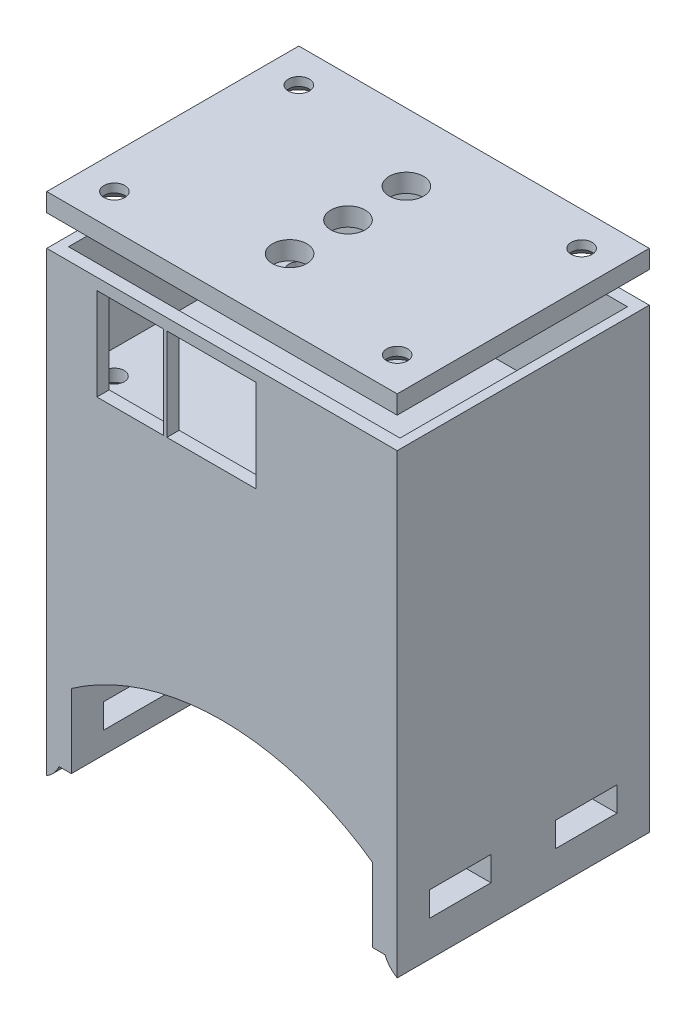
from build123d import *

# Parameters (mm, degrees)
SKETCH_2_W                  = 57
SKETCH_2_H                  = 41
EXTRUDE_1_DEPTH             = 2
SKETCH_1_R                  = 1.6
CUT_EXTRUDE_1_DEPTH         = 2
SKETCH_4_W                  = 57
SKETCH_4_H                  = 41
SKETCH_4_W_2                = 53.914285714
SKETCH_4_H_2                = 37
EXTRUDE_2_DEPTH             = 20
SKETCH_5_W                  = 10.8
SKETCH_5_H                  = 13
SKETCH_5_H_2                = 2
SKETCH_5_W_2                = 14.5
CUT_EXTRUDE_2_DEPTH         = 18.5
EXTRUDE_START               = 25
SKETCH_6_W                  = 57
SKETCH_6_H                  = 41
EXTRUDE_3_DEPTH             = 3
CUT_EXTRUDE_START           = 23
SKETCH_1_2_R                = 1.6
CUT_EXTRUDE_4_DEPTH         = 5
SKETCH_7_R                  = 2.8
CUT_EXTRUDE_5_DEPTH         = 4
SKETCH_8_W                  = 5
SKETCH_8_H                  = 5
CUT_EXTRUDE_6_DEPTH         = 10
SKETCH_9_W                  = 57
SKETCH_9_H                  = 41
EXTRUDE_4_DEPTH             = 40
SKETCH_10_R                 = 1.4
CUT_EXTRUDE_7_DEPTH         = 10
SKETCH_12_W                 = 8
SKETCH_12_H                 = 41
EXTRUDE_5_DEPTH             = 15
SKETCH_13_W                 = 4
SKETCH_13_H                 = 41
CUT_EXTRUDE_8_DEPTH         = 15
SKETCH_14_W                 = 2
SKETCH_14_H                 = 41
CUT_EXTRUDE_9_DEPTH         = 3
SKETCH_15_W                 = 10
SKETCH_15_H                 = 4
CUT_EXTRUDE_10_DEPTH        = 82.818396464
CUT_EXTRUDE_12_DEPTH        = 75.284924446
HOLE_WIZARD_M3_1_AT_2_COUNT = 2
HOLE_WIZARD_M3_1_AT_2_PITCH = 30
HOLE_WIZARD_M3_1_AT_3_COUNT = 2
HOLE_WIZARD_M3_1_AT_3_PITCH = 54.918120871
HOLE_WIZARD_M3_1_AT_4_COUNT = 2
HOLE_WIZARD_M3_1_AT_4_PITCH = 46
FILLET_1_R                  = 5


with BuildPart() as part:
    # 草图2 → 凸台-拉伸1 (new body)
    with BuildSketch(Plane(origin=(0, 0, 0), x_dir=(1, 0, 0), z_dir=(0, 1, 0))):
        Rectangle(SKETCH_2_W, SKETCH_2_H)
    extrude(amount=EXTRUDE_1_DEPTH)

    # 草图1 → 切除-拉伸1 (cut)
    with BuildSketch(Plane(origin=(0, 0, 0), x_dir=(1, 0, 0), z_dir=(0, 1, 0))):
        with Locations(Location((-23, 15, 0), (0, 0, 270))):
            Circle(SKETCH_1_R)
        with Locations(Location((-23, -15, 0), (0, 0, 270))):
            Circle(SKETCH_1_R)
        with Locations(Location((23, -15, 0), (0, 0, 270))):
            Circle(SKETCH_1_R)
        with Locations(Location((23, 15, 0), (0, 0, 270))):
            Circle(SKETCH_1_R)
    extrude(amount=CUT_EXTRUDE_1_DEPTH, mode=Mode.SUBTRACT)

    # 草图4 → 凸台-拉伸2 (add)
    with BuildSketch(Plane(origin=(0, 0, 0), x_dir=(1, 0, 0), z_dir=(0, 1, 0))):
        Rectangle(SKETCH_4_W, SKETCH_4_H)
        Rectangle(SKETCH_4_W_2, SKETCH_4_H_2, mode=Mode.SUBTRACT)
    extrude(amount=EXTRUDE_2_DEPTH)

    # 草图5 → 切除-拉伸2 (cut)
    with BuildSketch(Plane.XY.offset(20.5)):
        with Locations((-14.939380763, 9.639146882)):
            Rectangle(SKETCH_5_W, SKETCH_5_H)
        with Locations((-14.939380763, 17.139146882)):
            Rectangle(SKETCH_5_W, SKETCH_5_H_2)
        with Locations((-1.710619237, 9.639146882)):
            Rectangle(SKETCH_5_W_2, SKETCH_5_H)
        with Locations((-1.710619237, 17.139146882)):
            Rectangle(SKETCH_5_W_2, SKETCH_5_H_2)
    extrude(amount=-CUT_EXTRUDE_2_DEPTH, mode=Mode.SUBTRACT)

    # 草图8 → 切除-拉伸6 (cut)
    with BuildSketch(Plane.ZY.offset(28.5)):
        with Locations((-11.098227415, 17.5)):
            Rectangle(SKETCH_8_W, SKETCH_8_H)
    extrude(amount=-CUT_EXTRUDE_6_DEPTH, mode=Mode.SUBTRACT)

    # 草图9 → 凸台-拉伸4 (add)
    with BuildSketch(Plane.XZ):
        Rectangle(SKETCH_9_W, SKETCH_9_H)
    extrude(amount=EXTRUDE_4_DEPTH)

    # 草图10 → 切除-拉伸7 (cut)
    with BuildSketch(Plane(origin=(0, 2, 0), x_dir=(1, 0, 0), z_dir=(0, 1, 0))):
        with Locations(Location((-23, 15, 0), (0, 0, 270))):
            Circle(SKETCH_10_R)
        with Locations(Location((-23, -15, 0), (0, 0, 270))):
            Circle(SKETCH_10_R)
        with Locations(Location((23, -15, 0), (0, 0, 270))):
            Circle(SKETCH_10_R)
        with Locations(Location((23, 15, 0), (0, 0, 270))):
            Circle(SKETCH_10_R)
    extrude(amount=-CUT_EXTRUDE_7_DEPTH, mode=Mode.SUBTRACT)

    # 草图12 → 凸台-拉伸5 (add)
    with BuildSketch(Plane.XZ.offset(40)):
        with Locations((-24.5, 0)):
            Rectangle(SKETCH_12_W, SKETCH_12_H)
        with Locations((24.5, 0)):
            Rectangle(SKETCH_12_W, SKETCH_12_H)
    extrude(amount=EXTRUDE_5_DEPTH)

    # 草图13 → 切除-拉伸8 (cut)
    with BuildSketch(Plane.XZ.offset(55)):
        with Locations((-22.5, 0)):
            Rectangle(SKETCH_13_W, SKETCH_13_H)
        with Locations((22.5, 0)):
            Rectangle(SKETCH_13_W, SKETCH_13_H)
    extrude(amount=-CUT_EXTRUDE_8_DEPTH, mode=Mode.SUBTRACT)

    # 草图14 → 切除-拉伸9 (cut)
    with BuildSketch(Plane.XZ.offset(55)):
        with Locations((-25.5, 0)):
            Rectangle(SKETCH_14_W, SKETCH_14_H)
        with Locations((25.5, 0)):
            Rectangle(SKETCH_14_W, SKETCH_14_H)
    extrude(amount=-CUT_EXTRUDE_9_DEPTH, mode=Mode.SUBTRACT)

    # 草图15 → 切除-拉伸10 (cut, through all)
    with BuildSketch(Plane.ZY.offset(28.5)):
        with Locations((-10.25, -46.939346002)):
            Rectangle(SKETCH_15_W, SKETCH_15_H)
        with Locations((10.25, -46.496240266)):
            Rectangle(SKETCH_15_W, SKETCH_15_H)
    extrude(amount=-CUT_EXTRUDE_10_DEPTH, mode=Mode.SUBTRACT)

    # 草图19 → 切除-拉伸12 (cut, through all)
    with BuildSketch(Plane(origin=(0, 0, -20.5), x_dir=(-1, 0, 0), z_dir=(0, 0, -1))):
        with BuildLine():
            ThreePointArc((24.5, -40), (0, -32.224551533), (-24.5, -40))
            Line((-24.5, -40), (24.5, -40))
        make_face()
    extrude(amount=-CUT_EXTRUDE_12_DEPTH, mode=Mode.SUBTRACT)

    # 圆角1
    # the kernel refuses this fillet: 5 mm, written as the material it takes off along each edge
    with BuildSketch(Plane(origin=(26.5, -55, 31.956439237), x_dir=(0, 1, 0), z_dir=(0, 0, -1))) as fillet_1_piece_1:
        with BuildLine():
            CenterArc((5, 4.582575695), FILLET_1_R, 180, 66.421821522)
            Line((0, 4.582575695), (-0.1, 4.582575695))
            Line((-0.1, 4.582575695), (-0.1, 0))
            Line((-0.1, 0), (0, -0.1))
            ThreePointArc((0, -0.1), (1.5, -0.1), (2.96, -0.091651514))
            Line((2.96, -0.091651514), (3, 0))
        make_face()
    extrude(amount=63.912878475, mode=Mode.SUBTRACT)
    with BuildSketch(Plane(origin=(-26.5, -55, 31.956439237), x_dir=(0, 1, 0), z_dir=(0, 0, -1))) as fillet_1_piece_2:
        with BuildLine():
            CenterArc((5, -4.582575695), FILLET_1_R, 113.578178478, 66.421821522)
            Line((0, -4.582575695), (-0.1, -4.582575695))
            Line((-0.1, -4.582575695), (-0.1, 0))
            Line((-0.1, 0), (0, 0.1))
            ThreePointArc((0, 0.1), (1.5, 0.1), (2.96, 0.091651514))
            Line((2.96, 0.091651514), (3, 0))
        make_face()
    extrude(amount=63.912878475, mode=Mode.SUBTRACT)


with BuildPart() as body_2:
    # 草图6 → 凸台-拉伸3 (new body)
    with BuildSketch(Plane(origin=(0, 0, 0), x_dir=(1, 0, 0), z_dir=(0, 1, 0)).offset(EXTRUDE_START)):
        Rectangle(SKETCH_6_W, SKETCH_6_H)
    extrude(amount=EXTRUDE_3_DEPTH)

    # 草图1<2> → 切除-拉伸4 (cut)
    with BuildSketch(Plane(origin=(0, 0, 0), x_dir=(1, 0, 0), z_dir=(0, 1, 0)).offset(CUT_EXTRUDE_START)):
        with Locations(Location((-23, 15, 0), (0, 0, 270))):
            Circle(SKETCH_1_2_R)
        with Locations(Location((-23, -15, 0), (0, 0, 270))):
            Circle(SKETCH_1_2_R)
        with Locations(Location((23, -15, 0), (0, 0, 270))):
            Circle(SKETCH_1_2_R)
        with Locations(Location((23, 15, 0), (0, 0, 270))):
            Circle(SKETCH_1_2_R)
    extrude(amount=CUT_EXTRUDE_4_DEPTH, mode=Mode.SUBTRACT)

    # 草图7 → 切除-拉伸5 (cut)
    with BuildSketch(Plane.XZ.offset(-25)):
        with Locations(Location((0, 0, 0), (0, 0, 270))):
            Circle(SKETCH_7_R)
        with Locations(Location((0, -9.5, 0), (0, 0, 270))):
            Circle(SKETCH_7_R)
        with Locations(Location((0, 9.5, 0), (0, 0, 270))):
            Circle(SKETCH_7_R)
    extrude(amount=-CUT_EXTRUDE_5_DEPTH, mode=Mode.SUBTRACT)

    # 草图21 → M3 十字槽沉头木螺钉的锥形沉头孔1 (revolve, cut)
    with BuildSketch(Plane(origin=(-23, 25, 15), x_dir=(0, 0, -1), z_dir=(1, 0, 0))):
        Polygon((0, 0), (0, 3), (1.7, 3), (1.7, 1.6), (3.3, 0), align=None)
    hole_wizard_m3_1 = revolve(axis=Axis((-23, 18.65, 15), (0, 1, 0)), mode=Mode.SUBTRACT)

    # M3 十字槽沉头木螺钉的锥形沉头孔1 at 2: M3 十字槽沉头木螺钉的锥形沉头孔1 ×2
    with Locations(*[(0, 0, -i * HOLE_WIZARD_M3_1_AT_2_PITCH) for i in range(1, HOLE_WIZARD_M3_1_AT_2_COUNT)]):
        add(hole_wizard_m3_1, mode=Mode.SUBTRACT)

    # M3 十字槽沉头木螺钉的锥形沉头孔1 at 3: M3 十字槽沉头木螺钉的锥形沉头孔1 ×2
    with Locations(*[Vector(0.8376105968386142, 0, -0.5462677805469224) * (i * HOLE_WIZARD_M3_1_AT_3_PITCH) for i in range(1, HOLE_WIZARD_M3_1_AT_3_COUNT)]):
        add(hole_wizard_m3_1, mode=Mode.SUBTRACT)

    # M3 十字槽沉头木螺钉的锥形沉头孔1 at 4: M3 十字槽沉头木螺钉的锥形沉头孔1 ×2
    with Locations(*[(i * HOLE_WIZARD_M3_1_AT_4_PITCH, 0, 0) for i in range(1, HOLE_WIZARD_M3_1_AT_4_COUNT)]):
        add(hole_wizard_m3_1, mode=Mode.SUBTRACT)


solid = Compound([part.part, body_2.part])
